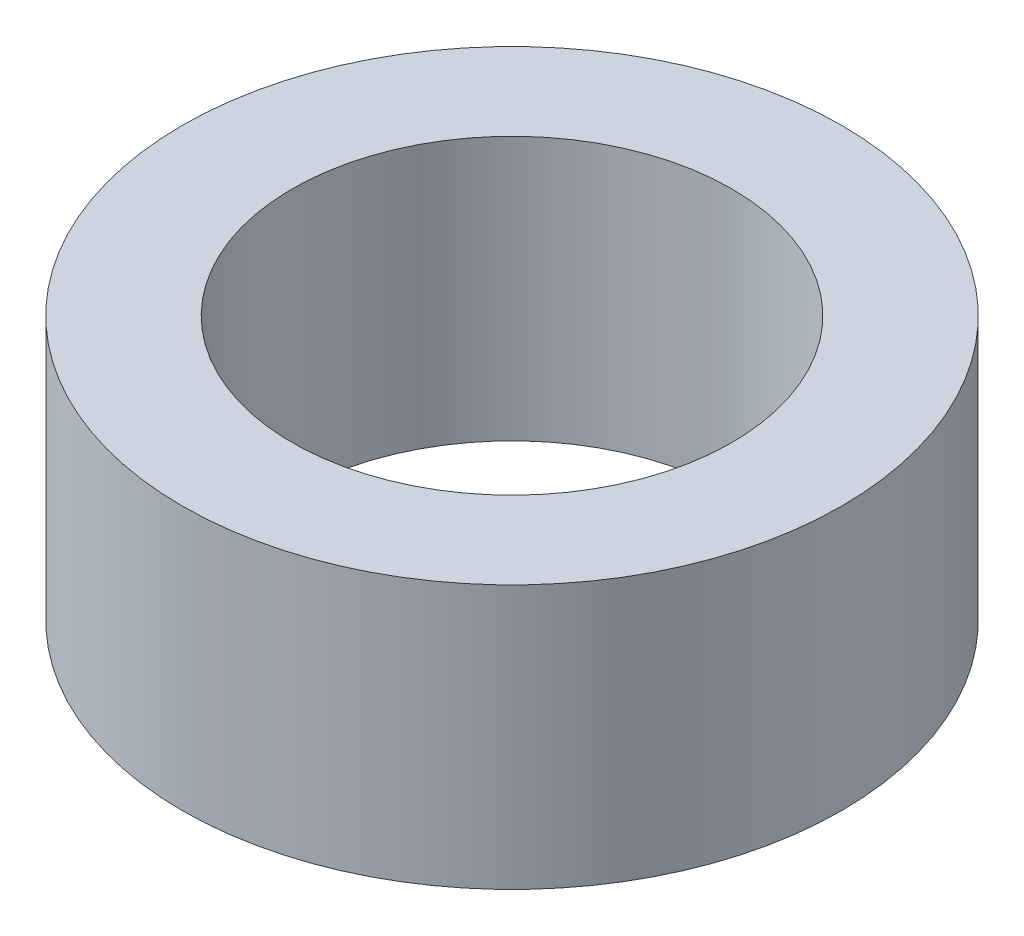
from build123d import *

# Parameters (mm, degrees)
SKETCH1_R           = 9.525
SKETCH1_R_2         = 6.35
BOSS_EXTRUDE1_DEPTH = 7.62


with BuildPart() as part:
    # Sketch1 → Boss-Extrude1 (new body)
    with BuildSketch(Plane(origin=(0, 0, 0), x_dir=(1, 0, 0), z_dir=(0, 1, 0))):
        Circle(SKETCH1_R)
        Circle(SKETCH1_R_2, mode=Mode.SUBTRACT)
    extrude(amount=BOSS_EXTRUDE1_DEPTH)


solid = part.part
